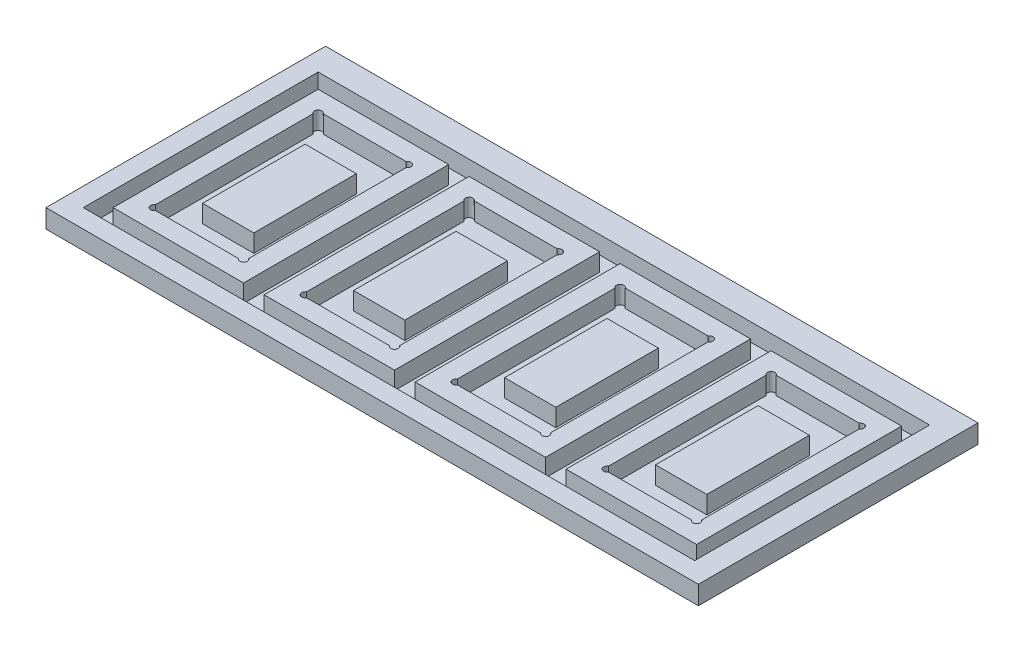
from build123d import *

# Parameters (mm, degrees)
SKETCH1_W           = 350
SKETCH1_H           = 150
BOSS_EXTRUDE1_DEPTH = 10
SKETCH2_W           = 328
SKETCH2_H           = 126
SKETCH2_W_2         = 70
SKETCH2_H_2         = 110
SKETCH2_W_3         = 27.5
SKETCH2_H_3         = 55
CUT_EXTRUDE1_DEPTH  = 9.5


with BuildPart() as part:
    # Sketch1 → Boss-Extrude1 (new body)
    with BuildSketch(Plane(origin=(0, 0, 0), x_dir=(1, 0, 0), z_dir=(0, 1, 0))):
        Rectangle(SKETCH1_W, SKETCH1_H)
    extrude(amount=BOSS_EXTRUDE1_DEPTH)

    # Sketch2 → Cut-Extrude1 (cut)
    # profile 1 of 5: a face of its own
    with BuildSketch(Plane(origin=(0, 10, 0), x_dir=(1, 0, 0), z_dir=(0, 1, 0))):
        with Locations((-1, -2)):
            Rectangle(SKETCH2_W, SKETCH2_H)
        with Locations((-122, -2)):
            Rectangle(SKETCH2_W_2, SKETCH2_H_2, mode=Mode.SUBTRACT)
        with Locations((-41, -2)):
            Rectangle(SKETCH2_W_2, SKETCH2_H_2, mode=Mode.SUBTRACT)
        with Locations((40, -2)):
            Rectangle(SKETCH2_W_2, SKETCH2_H_2, mode=Mode.SUBTRACT)
        with Locations((121, -2)):
            Rectangle(SKETCH2_W_2, SKETCH2_H_2, mode=Mode.SUBTRACT)
    # profile 2 of 5: a face of its own
    with BuildSketch(Plane(origin=(0, 10, 0), x_dir=(1, 0, 0), z_dir=(0, 1, 0))):
        with BuildLine():
            Line((-99.756242668, 43), (-144.243757332, 43))
            ThreePointArc((-144.243757332, 43), (-147.353553391, 43.353553391), (-147, 40.243757332))
            Line((-147, 40.243757332), (-147, -44.243757332))
            ThreePointArc((-147, -44.243757332), (-147.353553391, -47.353553391), (-144.243757332, -47))
            Line((-144.243757332, -47), (-99.756242668, -47))
            ThreePointArc((-99.756242668, -47), (-96.646446609, -47.353553391), (-97, -44.243757332))
            Line((-97, -44.243757332), (-97, 40.243757332))
            ThreePointArc((-97, 40.243757332), (-96.646446609, 43.353553391), (-99.756242668, 43))
        make_face()
        with Locations((-121.25, -3.5)):
            Rectangle(SKETCH2_W_3, SKETCH2_H_3, mode=Mode.SUBTRACT)
    # profile 3 of 5: a face of its own
    with BuildSketch(Plane(origin=(0, 10, 0), x_dir=(1, 0, 0), z_dir=(0, 1, 0))):
        with BuildLine():
            Line((-18.756242668, 43), (-63.243757332, 43))
            ThreePointArc((-63.243757332, 43), (-66.353553391, 43.353553391), (-66, 40.243757332))
            Line((-66, 40.243757332), (-66, -44.243757332))
            ThreePointArc((-66, -44.243757332), (-66.353553391, -47.353553391), (-63.243757332, -47))
            Line((-63.243757332, -47), (-18.756242668, -47))
            ThreePointArc((-18.756242668, -47), (-15.646446609, -47.353553391), (-16, -44.243757332))
            Line((-16, -44.243757332), (-16, 40.243757332))
            ThreePointArc((-16, 40.243757332), (-15.646446609, 43.353553391), (-18.756242668, 43))
        make_face()
        with Locations((-40.25, -3.5)):
            Rectangle(SKETCH2_W_3, SKETCH2_H_3, mode=Mode.SUBTRACT)
    # profile 4 of 5: a face of its own
    with BuildSketch(Plane(origin=(0, 10, 0), x_dir=(1, 0, 0), z_dir=(0, 1, 0))):
        with BuildLine():
            Line((62.243757332, 43), (17.756242668, 43))
            ThreePointArc((17.756242668, 43), (14.646446609, 43.353553391), (15, 40.243757332))
            Line((15, 40.243757332), (15, -44.243757332))
            ThreePointArc((15, -44.243757332), (14.646446609, -47.353553391), (17.756242668, -47))
            Line((17.756242668, -47), (62.243757332, -47))
            ThreePointArc((62.243757332, -47), (65.353553391, -47.353553391), (65, -44.243757332))
            Line((65, -44.243757332), (65, 40.243757332))
            ThreePointArc((65, 40.243757332), (65.353553391, 43.353553391), (62.243757332, 43))
        make_face()
        with Locations((40.75, -3.5)):
            Rectangle(SKETCH2_W_3, SKETCH2_H_3, mode=Mode.SUBTRACT)
    # profile 5 of 5: a face of its own
    with BuildSketch(Plane(origin=(0, 10, 0), x_dir=(1, 0, 0), z_dir=(0, 1, 0))):
        with BuildLine():
            Line((143.243757332, 43), (98.756242668, 43))
            ThreePointArc((98.756242668, 43), (95.646446609, 43.353553391), (96, 40.243757332))
            Line((96, 40.243757332), (96, -44.243757332))
            ThreePointArc((96, -44.243757332), (95.646446609, -47.353553391), (98.756242668, -47))
            Line((98.756242668, -47), (143.243757332, -47))
            ThreePointArc((143.243757332, -47), (146.353553391, -47.353553391), (146, -44.243757332))
            Line((146, -44.243757332), (146, 40.243757332))
            ThreePointArc((146, 40.243757332), (146.353553391, 43.353553391), (143.243757332, 43))
        make_face()
        with Locations((121.75, -3.5)):
            Rectangle(SKETCH2_W_3, SKETCH2_H_3, mode=Mode.SUBTRACT)
    extrude(amount=-CUT_EXTRUDE1_DEPTH, mode=Mode.SUBTRACT)


solid = part.part
